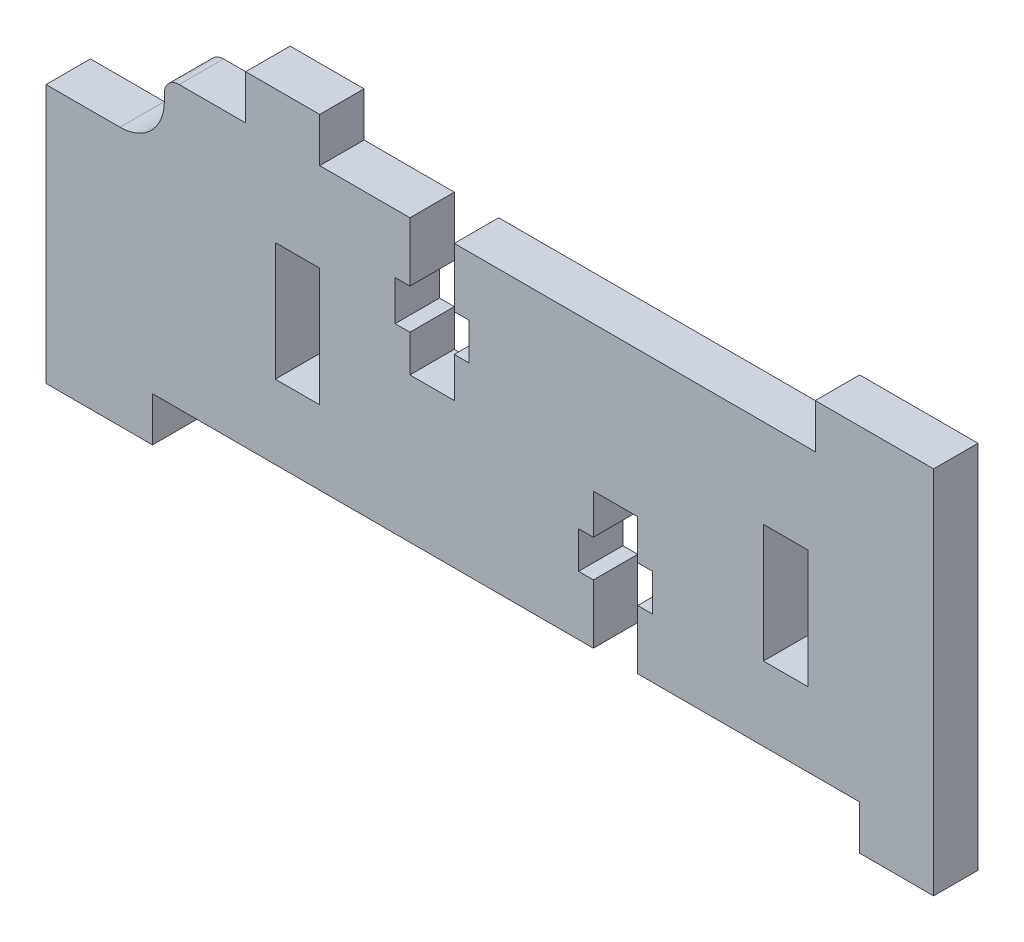
from build123d import *

# Parameters (mm, degrees)
ESQUISSE1_W               = 3
ESQUISSE1_H               = 8
T_LE_DE_BASE_PLI_E1_DEPTH = 3
CONG_1_R                  = 1


# Sheet-metal steps are written as plain solids
with BuildPart() as part:
    # Esquisse1 → Tôle de base pliée1 (new body)
    with BuildSketch(Plane.XY):
        with BuildLine():
            Line((60, 25), (60, 0))
            Line((60, 0), (55, 0))
            Line((55, 0), (55, 3))
            Line((55, 3), (40, 3))
            Line((40, 3), (40, 7))
            Line((40, 7), (41, 7))
            Line((41, 7), (41, 9.5))
            Line((41, 9.5), (40, 9.5))
            Line((40, 9.5), (40, 12.2))
            Line((40, 12.2), (37, 12.2))
            Line((37, 12.2), (37, 9.5))
            Line((37, 9.5), (36, 9.5))
            Line((36, 9.5), (36, 7))
            Line((36, 7), (37, 7))
            Line((37, 7), (37, 3))
            Line((37, 3), (7.2, 3))
            Line((7.2, 3), (7.2, 0))
            Line((7.2, 0), (0, 0))
            Line((0, 0), (0, 17.5))
            Line((0, 17.5), (5, 17.5))
            ThreePointArc((5, 17.5), (7.121320344, 18.378679656), (8, 20.5))
            Line((8, 20.5), (8, 22))
            Line((8, 22), (13.5, 22))
            Line((13.5, 22), (13.5, 25))
            Line((13.5, 25), (18.5, 25))
            Line((18.5, 25), (18.5, 22))
            Line((18.5, 22), (24.6, 22))
            Line((24.6, 22), (24.6, 18))
            Line((24.6, 18), (23.6, 18))
            Line((23.6, 18), (23.6, 15.3))
            Line((23.6, 15.3), (24.6, 15.3))
            Line((24.6, 15.3), (24.6, 12.8))
            Line((24.6, 12.8), (27.6, 12.8))
            Line((27.6, 12.8), (27.6, 15.5))
            Line((27.6, 15.5), (28.6, 15.5))
            Line((28.6, 15.5), (28.6, 18))
            Line((28.6, 18), (27.6, 18))
            Line((27.6, 18), (27.6, 22))
            Line((27.6, 22), (52, 22))
            Line((52, 22), (52, 25))
            Line((52, 25), (60, 25))
        make_face()
        with Locations((17, 12)):
            Rectangle(ESQUISSE1_W, ESQUISSE1_H, mode=Mode.SUBTRACT)
        with Locations((50, 12)):
            Rectangle(ESQUISSE1_W, ESQUISSE1_H, mode=Mode.SUBTRACT)
    extrude(amount=-T_LE_DE_BASE_PLI_E1_DEPTH)

    # Congé1
    cong_1_edges = [part.edges().sort_by_distance(p)[0] for p in [
        (8, 22, -1.5),
    ]]
    fillet(cong_1_edges, radius=CONG_1_R)


solid = part.part
